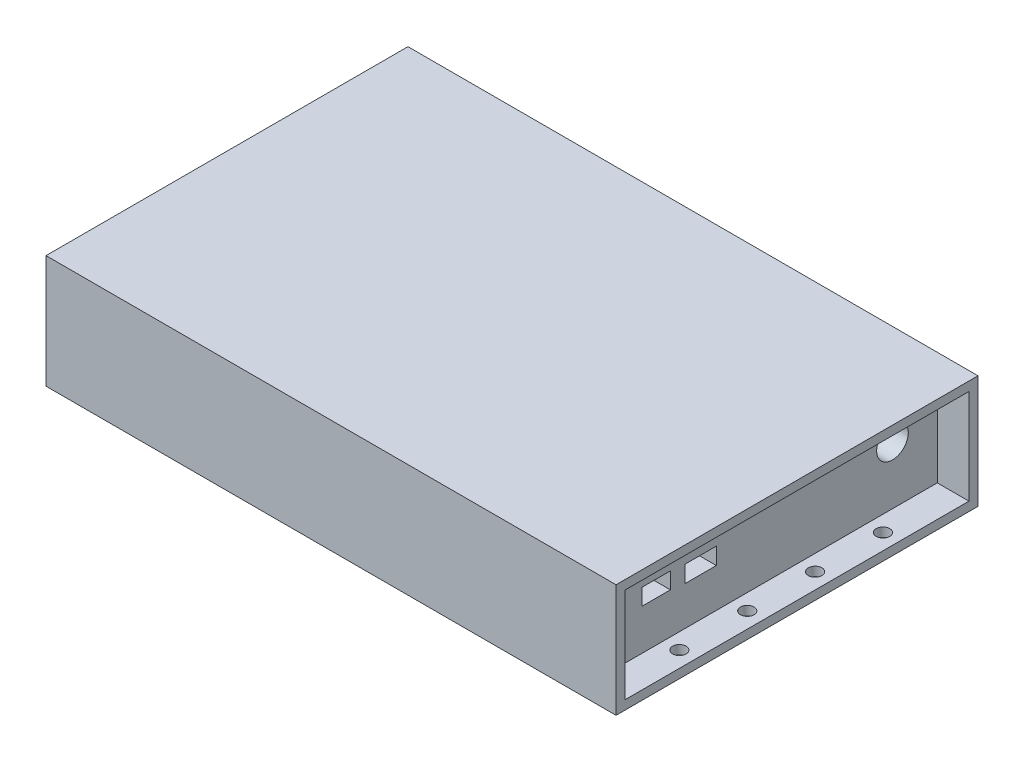
from build123d import *

# Parameters (mm, degrees)
SKETCH_1_W          = 126
SKETCH_1_H          = 80
EXTRUDE_1_DEPTH     = 25
SKETCH_2_W          = 76
SKETCH_2_H          = 21
CUT_EXTRUDE_1_DEPTH = 7
SKETCH_3_W          = 76
SKETCH_3_H          = 21
CUT_EXTRUDE_2_DEPTH = 7
SKETCH_4_R          = 3.5
CUT_EXTRUDE_3_DEPTH = 7
SKETCH_5_R          = 1.5
CUT_EXTRUDE_5_DEPTH = 23
SKETCH_6_R          = 1.5
CUT_EXTRUDE_6_DEPTH = 23
SKETCH_8_W          = 6.231296242
SKETCH_8_H          = 3.629881306
SKETCH_8_W_2        = 6.957272504
SKETCH_8_H_2        = 3.720628339
CUT_EXTRUDE_7_DEPTH = 10


with BuildPart() as part:
    # 草图1 → 凸台-拉伸1 (new body)
    with BuildSketch(Plane(origin=(0, 0, 0), x_dir=(1, 0, 0), z_dir=(0, 1, 0))):
        with Locations((63, -40)):
            Rectangle(SKETCH_1_W, SKETCH_1_H)
    extrude(amount=EXTRUDE_1_DEPTH)

    # 草图2 → 切除-拉伸1 (cut)
    with BuildSketch(Plane(origin=(126, 0, 0), x_dir=(0, 0, -1), z_dir=(1, 0, 0))):
        with Locations((-40, 12.5)):
            Rectangle(SKETCH_2_W, SKETCH_2_H)
    extrude(amount=-CUT_EXTRUDE_1_DEPTH, mode=Mode.SUBTRACT)

    # 草图3 → 切除-拉伸2 (cut)
    with BuildSketch(Plane.ZY):
        with Locations((40, 12.5)):
            Rectangle(SKETCH_3_W, SKETCH_3_H)
    extrude(amount=-CUT_EXTRUDE_2_DEPTH, mode=Mode.SUBTRACT)

    # 草图4 → 切除-拉伸3 (cut)
    with BuildSketch(Plane(origin=(119, 0, 0), x_dir=(0, 0, -1), z_dir=(1, 0, 0))):
        with Locations((-11.90518779, 14.841361907)):
            Circle(SKETCH_4_R)
    extrude(amount=-CUT_EXTRUDE_3_DEPTH, mode=Mode.SUBTRACT)

    # 草图5 → 切除-拉伸5 (cut)
    with BuildSketch(Plane(origin=(0, 2, 0), x_dir=(1, 0, 0), z_dir=(0, 1, 0))):
        with Locations((122.5, -17.5)):
            Circle(SKETCH_5_R)
        with Locations((122.5, -32.5)):
            Circle(SKETCH_5_R)
        with Locations((122.5, -47.5)):
            Circle(SKETCH_5_R)
        with Locations((122.5, -62.5)):
            Circle(SKETCH_5_R)
    extrude(amount=-CUT_EXTRUDE_5_DEPTH, mode=Mode.SUBTRACT)

    # 草图6 → 切除-拉伸6 (cut)
    with BuildSketch(Plane(origin=(0, 2, 0), x_dir=(1, 0, 0), z_dir=(0, 1, 0))):
        with Locations((3.5, -17.5)):
            Circle(SKETCH_6_R)
        with Locations((3.5, -32.5)):
            Circle(SKETCH_6_R)
        with Locations((3.5, -47.5)):
            Circle(SKETCH_6_R)
        with Locations((3.5, -62.5)):
            Circle(SKETCH_6_R)
    extrude(amount=-CUT_EXTRUDE_6_DEPTH, mode=Mode.SUBTRACT)

    # 草图8 → 切除-拉伸7 (cut)
    with BuildSketch(Plane(origin=(119, 0, 0), x_dir=(0, 0, -1), z_dir=(1, 0, 0))):
        with Locations((-64.108461677, 12.83273912)):
            Rectangle(SKETCH_8_W, SKETCH_8_H)
        with Locations((-54.30778215, 12.454626484)):
            Rectangle(SKETCH_8_W_2, SKETCH_8_H_2)
    extrude(amount=-CUT_EXTRUDE_7_DEPTH, mode=Mode.SUBTRACT)


solid = part.part
